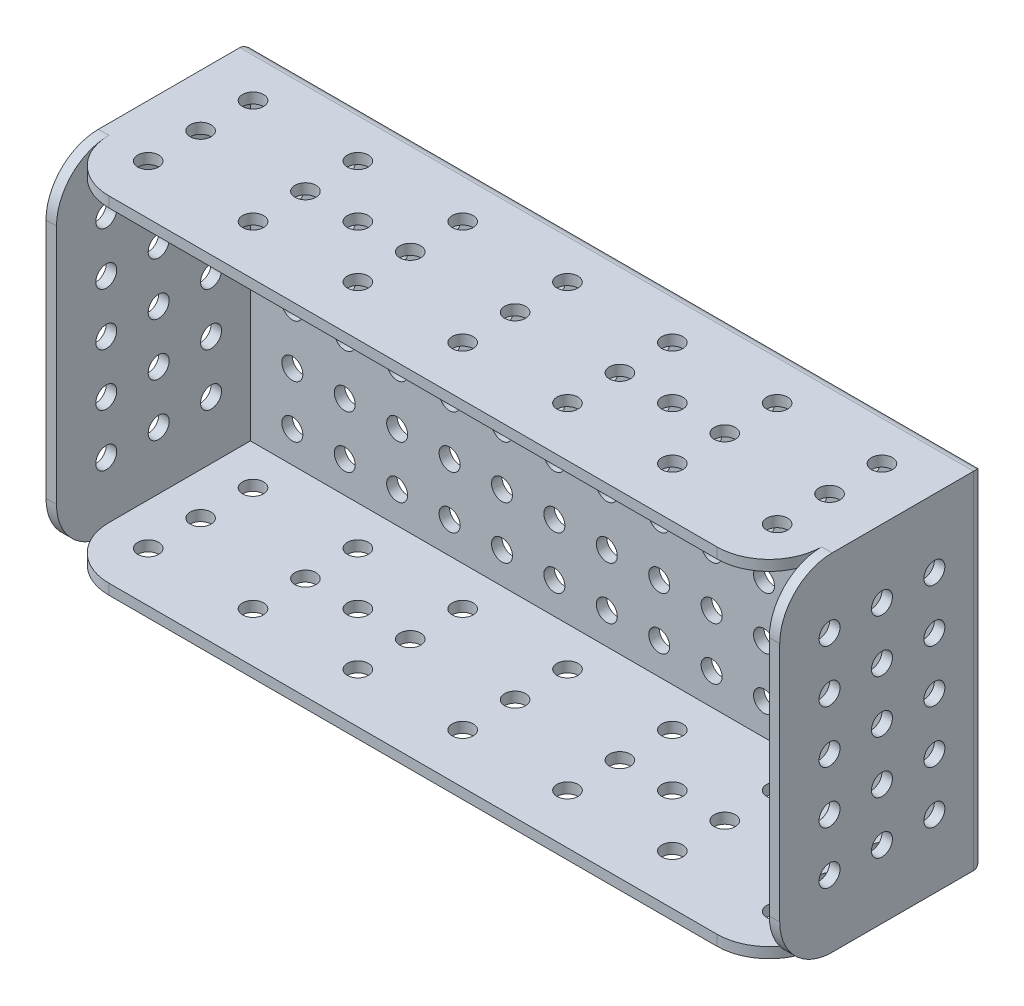
from build123d import *

# Parameters (mm, degrees)
IZIM1_W                     = 140
IZIM1_H                     = 66
Y_KSEKLIK_EKSTR_ZYON1_DEPTH = 2
IZIM2_W                     = 2
IZIM2_H                     = 66
Y_KSEKLIK_EKSTR_ZYON2_DEPTH = 37
RADYUS1_R                   = 10
IZIM3_W                     = 136
IZIM3_H                     = 2
Y_KSEKLIK_EKSTR_ZYON3_DEPTH = 37
RADYUS2_R                   = 10
IZIM4_R                     = 2
KES_EKSTR_ZYON1_DEPTH       = 37
IZIM6_R                     = 2
KES_EKSTR_ZYON2_DEPTH       = 150.108833091
IZIM7_R                     = 2
KES_EKSTR_ZYON3_DEPTH       = 106.654219597
RADYUS3_R                   = 2


with BuildPart() as part:
    # Çizim1 → Yükseklik-Ekstrüzyon1 (new body)
    with BuildSketch(Plane.XY):
        with Locations((-2.703604578, 0.353322259)):
            Rectangle(IZIM1_W, IZIM1_H)
    extrude(amount=Y_KSEKLIK_EKSTR_ZYON1_DEPTH)

    # Çizim2 → Yükseklik-Ekstrüzyon2 (add)
    with BuildSketch(Plane.XY.offset(2)):
        with Locations((-71.703604578, 0.353322259)):
            Rectangle(IZIM2_W, IZIM2_H)
        with Locations((66.296395422, 0.353322259)):
            Rectangle(IZIM2_W, IZIM2_H)
    extrude(amount=Y_KSEKLIK_EKSTR_ZYON2_DEPTH)

    # Radyus1
    radyus1_edges = [part.edges().sort_by_distance(p)[0] for p in [
        (-71.703604578, -32.646677741, 39),
        (66.296395422, -32.646677741, 39),
        (66.296395422, 33.353322259, 39),
        (-71.703604578, 33.353322259, 39),
    ]]
    fillet(radyus1_edges, radius=RADYUS1_R)

    # Çizim3 → Yükseklik-Ekstrüzyon3 (add)
    with BuildSketch(Plane.XY.offset(2)):
        with Locations((-2.703604578, 32.353322259)):
            Rectangle(IZIM3_W, IZIM3_H)
        with Locations((-2.703604578, -31.646677741)):
            Rectangle(IZIM3_W, IZIM3_H)
    extrude(amount=Y_KSEKLIK_EKSTR_ZYON3_DEPTH)

    # Radyus2
    # the kernel refuses this fillet: 10 mm, written as the material it takes off along each edge
    with BuildSketch(Plane(origin=(-70.703604578, -5.646677741, 39), x_dir=(0, 0, -1), z_dir=(0, -1, 0)), Plane(origin=(65.296395422, -57.646677741, 39), x_dir=(0, 0, -1), z_dir=(0, 1, 0))) as radyus2_piece_1:
        with BuildLine():
            CenterArc((RADYUS2_R, RADYUS2_R), RADYUS2_R, 180, 90)
            Line((0, RADYUS2_R), (0, 0))
            Line((0, 0), (RADYUS2_R, 0))
        make_face()
    extrude(amount=52, mode=Mode.SUBTRACT)
    with BuildSketch(Plane(origin=(65.296395422, 58.353322259, 39), x_dir=(0, 0, -1), z_dir=(0, -1, 0)), Plane(origin=(-70.703604578, 6.353322259, 39), x_dir=(0, 0, -1), z_dir=(0, 1, 0))) as radyus2_piece_2:
        with BuildLine():
            CenterArc((RADYUS2_R, -RADYUS2_R), RADYUS2_R, 90, 90)
            Line((0, -RADYUS2_R), (0, 0))
            Line((0, 0), (RADYUS2_R, 0))
        make_face()
    extrude(amount=52, mode=Mode.SUBTRACT)

    # Çizim4 → Kes-Ekstrüzyon1 (cut)
    with BuildSketch(Plane(origin=(0, 0, 0), x_dir=(-1, 0, 0), z_dir=(0, 0, -1))):
        with Locations((-57.296395422, 25.353322259)):
            Circle(IZIM4_R)
        with Locations((-47.296395422, 25.353322259)):
            Circle(IZIM4_R)
        with Locations((-37.296395422, 25.353322259)):
            Circle(IZIM4_R)
        with Locations((-27.296395422, 25.353322259)):
            Circle(IZIM4_R)
        with Locations((-17.296395422, 25.353322259)):
            Circle(IZIM4_R)
        with Locations((-7.296395422, 25.353322259)):
            Circle(IZIM4_R)
        with Locations((2.703604578, 25.353322259)):
            Circle(IZIM4_R)
        with Locations((12.703604578, 25.353322259)):
            Circle(IZIM4_R)
        with Locations((22.703604578, 25.353322259)):
            Circle(IZIM4_R)
        with Locations((32.703604578, 25.353322259)):
            Circle(IZIM4_R)
        with Locations((42.703604578, 25.353322259)):
            Circle(IZIM4_R)
        with Locations((52.703604578, 25.353322259)):
            Circle(IZIM4_R)
        with Locations((62.703604578, 25.353322259)):
            Circle(IZIM4_R)
        with Locations((-47.296395422, 15.353322259)):
            Circle(IZIM4_R)
        with Locations((-37.296395422, 15.353322259)):
            Circle(IZIM4_R)
        with Locations((-27.296395422, 15.353322259)):
            Circle(IZIM4_R)
        with Locations((-17.296395422, 15.353322259)):
            Circle(IZIM4_R)
        with Locations((-7.296395422, 15.353322259)):
            Circle(IZIM4_R)
        with Locations((2.703604578, 15.353322259)):
            Circle(IZIM4_R)
        with Locations((12.703604578, 15.353322259)):
            Circle(IZIM4_R)
        with Locations((22.703604578, 15.353322259)):
            Circle(IZIM4_R)
        with Locations((32.703604578, 15.353322259)):
            Circle(IZIM4_R)
        with Locations((42.703604578, 15.353322259)):
            Circle(IZIM4_R)
        with Locations((52.703604578, 15.353322259)):
            Circle(IZIM4_R)
        with Locations((62.703604578, 15.353322259)):
            Circle(IZIM4_R)
        with Locations((-47.296395422, 5.353322259)):
            Circle(IZIM4_R)
        with Locations((-37.296395422, 5.353322259)):
            Circle(IZIM4_R)
        with Locations((-27.296395422, 5.353322259)):
            Circle(IZIM4_R)
        with Locations((-17.296395422, 5.353322259)):
            Circle(IZIM4_R)
        with Locations((-7.296395422, 5.353322259)):
            Circle(IZIM4_R)
        with Locations((2.703604578, 5.353322259)):
            Circle(IZIM4_R)
        with Locations((12.703604578, 5.353322259)):
            Circle(IZIM4_R)
        with Locations((22.703604578, 5.353322259)):
            Circle(IZIM4_R)
        with Locations((32.703604578, 5.353322259)):
            Circle(IZIM4_R)
        with Locations((42.703604578, 5.353322259)):
            Circle(IZIM4_R)
        with Locations((52.703604578, 5.353322259)):
            Circle(IZIM4_R)
        with Locations((62.703604578, 5.353322259)):
            Circle(IZIM4_R)
        with Locations((-47.296395422, -4.646677741)):
            Circle(IZIM4_R)
        with Locations((-37.296395422, -4.646677741)):
            Circle(IZIM4_R)
        with Locations((-27.296395422, -4.646677741)):
            Circle(IZIM4_R)
        with Locations((-17.296395422, -4.646677741)):
            Circle(IZIM4_R)
        with Locations((-7.296395422, -4.646677741)):
            Circle(IZIM4_R)
        with Locations((2.703604578, -4.646677741)):
            Circle(IZIM4_R)
        with Locations((12.703604578, -4.646677741)):
            Circle(IZIM4_R)
        with Locations((22.703604578, -4.646677741)):
            Circle(IZIM4_R)
        with Locations((32.703604578, -4.646677741)):
            Circle(IZIM4_R)
        with Locations((42.703604578, -4.646677741)):
            Circle(IZIM4_R)
        with Locations((52.703604578, -4.646677741)):
            Circle(IZIM4_R)
        with Locations((62.703604578, -4.646677741)):
            Circle(IZIM4_R)
        with Locations((-47.296395422, -14.646677741)):
            Circle(IZIM4_R)
        with Locations((-37.296395422, -14.646677741)):
            Circle(IZIM4_R)
        with Locations((-27.296395422, -14.646677741)):
            Circle(IZIM4_R)
        with Locations((-17.296395422, -14.646677741)):
            Circle(IZIM4_R)
        with Locations((-7.296395422, -14.646677741)):
            Circle(IZIM4_R)
        with Locations((2.703604578, -14.646677741)):
            Circle(IZIM4_R)
        with Locations((12.703604578, -14.646677741)):
            Circle(IZIM4_R)
        with Locations((22.703604578, -14.646677741)):
            Circle(IZIM4_R)
        with Locations((32.703604578, -14.646677741)):
            Circle(IZIM4_R)
        with Locations((42.703604578, -14.646677741)):
            Circle(IZIM4_R)
        with Locations((52.703604578, -14.646677741)):
            Circle(IZIM4_R)
        with Locations((62.703604578, -14.646677741)):
            Circle(IZIM4_R)
        with Locations((-47.296395422, -24.646677741)):
            Circle(IZIM4_R)
        with Locations((-37.296395422, -24.646677741)):
            Circle(IZIM4_R)
        with Locations((-27.296395422, -24.646677741)):
            Circle(IZIM4_R)
        with Locations((-17.296395422, -24.646677741)):
            Circle(IZIM4_R)
        with Locations((-7.296395422, -24.646677741)):
            Circle(IZIM4_R)
        with Locations((2.703604578, -24.646677741)):
            Circle(IZIM4_R)
        with Locations((12.703604578, -24.646677741)):
            Circle(IZIM4_R)
        with Locations((22.703604578, -24.646677741)):
            Circle(IZIM4_R)
        with Locations((32.703604578, -24.646677741)):
            Circle(IZIM4_R)
        with Locations((42.703604578, -24.646677741)):
            Circle(IZIM4_R)
        with Locations((52.703604578, -24.646677741)):
            Circle(IZIM4_R)
        with Locations((62.703604578, -24.646677741)):
            Circle(IZIM4_R)
        with Locations((-57.296395422, 15.353322259)):
            Circle(IZIM4_R)
        with Locations((-57.296395422, 5.353322259)):
            Circle(IZIM4_R)
        with Locations((-57.296395422, -4.646677741)):
            Circle(IZIM4_R)
        with Locations((-57.296395422, -14.646677741)):
            Circle(IZIM4_R)
        with Locations((-57.296395422, -24.646677741)):
            Circle(IZIM4_R)
    extrude(amount=-KES_EKSTR_ZYON1_DEPTH, mode=Mode.SUBTRACT)

    # Çizim6 → Kes-Ekstrüzyon2 (cut, through all)
    with BuildSketch(Plane.ZY.offset(72.703604578)):
        with Locations(Location((9.5, -19.646677741, 0), (0, 0, 270))):
            Circle(IZIM6_R)
        with Locations(Location((19.5, -19.646677741, 0), (0, 0, 270))):
            Circle(IZIM6_R)
        with Locations(Location((29.5, -19.646677741, 0), (0, 0, 270))):
            Circle(IZIM6_R)
        with Locations(Location((19.5, -9.646677741, 0), (0, 0, 270))):
            Circle(IZIM6_R)
        with Locations(Location((29.5, -9.646677741, 0), (0, 0, 270))):
            Circle(IZIM6_R)
        with Locations(Location((19.5, 0.353322259, 0), (0, 0, 270))):
            Circle(IZIM6_R)
        with Locations(Location((29.5, 0.353322259, 0), (0, 0, 270))):
            Circle(IZIM6_R)
        with Locations(Location((19.5, 10.353322259, 0), (0, 0, 270))):
            Circle(IZIM6_R)
        with Locations(Location((29.5, 10.353322259, 0), (0, 0, 270))):
            Circle(IZIM6_R)
        with Locations(Location((19.5, 20.353322259, 0), (0, 0, 270))):
            Circle(IZIM6_R)
        with Locations(Location((29.5, 20.353322259, 0), (0, 0, 270))):
            Circle(IZIM6_R)
        with Locations(Location((9.5, -9.646677741, 0), (0, 0, 270))):
            Circle(IZIM6_R)
        with Locations(Location((9.5, 0.353322259, 0), (0, 0, 270))):
            Circle(IZIM6_R)
        with Locations(Location((9.5, 10.353322259, 0), (0, 0, 270))):
            Circle(IZIM6_R)
        with Locations(Location((9.5, 20.353322259, 0), (0, 0, 270))):
            Circle(IZIM6_R)
    extrude(amount=-KES_EKSTR_ZYON2_DEPTH, mode=Mode.SUBTRACT)

    # Çizim7 → Kes-Ekstrüzyon3 (cut, through all)
    with BuildSketch(Plane(origin=(0, 33.353322259, 0), x_dir=(1, 0, 0), z_dir=(0, 1, 0))):
        with Locations(Location((-62.703604578, -9.5, 0), (0, 0, 270))):
            Circle(IZIM7_R)
        with Locations(Location((-42.703604578, -9.5, 0), (0, 0, 270))):
            Circle(IZIM7_R)
        with Locations(Location((-22.703604578, -9.5, 0), (0, 0, 270))):
            Circle(IZIM7_R)
        with Locations(Location((-2.703604578, -9.5, 0), (0, 0, 270))):
            Circle(IZIM7_R)
        with Locations(Location((17.296395422, -9.5, 0), (0, 0, 270))):
            Circle(IZIM7_R)
        with Locations(Location((37.296395422, -9.5, 0), (0, 0, 270))):
            Circle(IZIM7_R)
        with Locations(Location((57.296395422, -9.5, 0), (0, 0, 270))):
            Circle(IZIM7_R)
        with Locations(Location((-42.703604578, -19.5, 0), (0, 0, 270))):
            Circle(IZIM7_R)
        with Locations(Location((-22.703604578, -19.5, 0), (0, 0, 270))):
            Circle(IZIM7_R)
        with Locations(Location((-2.703604578, -19.5, 0), (0, 0, 270))):
            Circle(IZIM7_R)
        with Locations(Location((17.296395422, -19.5, 0), (0, 0, 270))):
            Circle(IZIM7_R)
        with Locations(Location((37.296395422, -19.5, 0), (0, 0, 270))):
            Circle(IZIM7_R)
        with Locations(Location((57.296395422, -19.5, 0), (0, 0, 270))):
            Circle(IZIM7_R)
        with Locations(Location((-42.703604578, -29.5, 0), (0, 0, 270))):
            Circle(IZIM7_R)
        with Locations(Location((-22.703604578, -29.5, 0), (0, 0, 270))):
            Circle(IZIM7_R)
        with Locations(Location((-2.703604578, -29.5, 0), (0, 0, 270))):
            Circle(IZIM7_R)
        with Locations(Location((17.296395422, -29.5, 0), (0, 0, 270))):
            Circle(IZIM7_R)
        with Locations(Location((37.296395422, -29.5, 0), (0, 0, 270))):
            Circle(IZIM7_R)
        with Locations(Location((57.296395422, -29.5, 0), (0, 0, 270))):
            Circle(IZIM7_R)
        with Locations(Location((-62.703604578, -19.5, 0), (0, 0, 270))):
            Circle(IZIM7_R)
        with Locations(Location((-62.703604578, -29.5, 0), (0, 0, 270))):
            Circle(IZIM7_R)
        with Locations(Location((-32.703604578, -19.5, 0), (0, 0, 270))):
            Circle(IZIM7_R)
        with Locations(Location((27.296395422, -19.5, 0), (0, 0, 270))):
            Circle(IZIM7_R)
    extrude(amount=-KES_EKSTR_ZYON3_DEPTH, mode=Mode.SUBTRACT)

    # Radyus3
    radyus3_edges = [part.edges().sort_by_distance(p)[0] for p in [
        (-2.703604578, 33.353322259, 0),
        (67.296395422, 0.353322259, 0),
        (-2.703604578, -32.646677741, 0),
        (-72.703604578, 0.353322259, 0),
    ]]
    fillet(radyus3_edges, radius=RADYUS3_R)


solid = part.part
